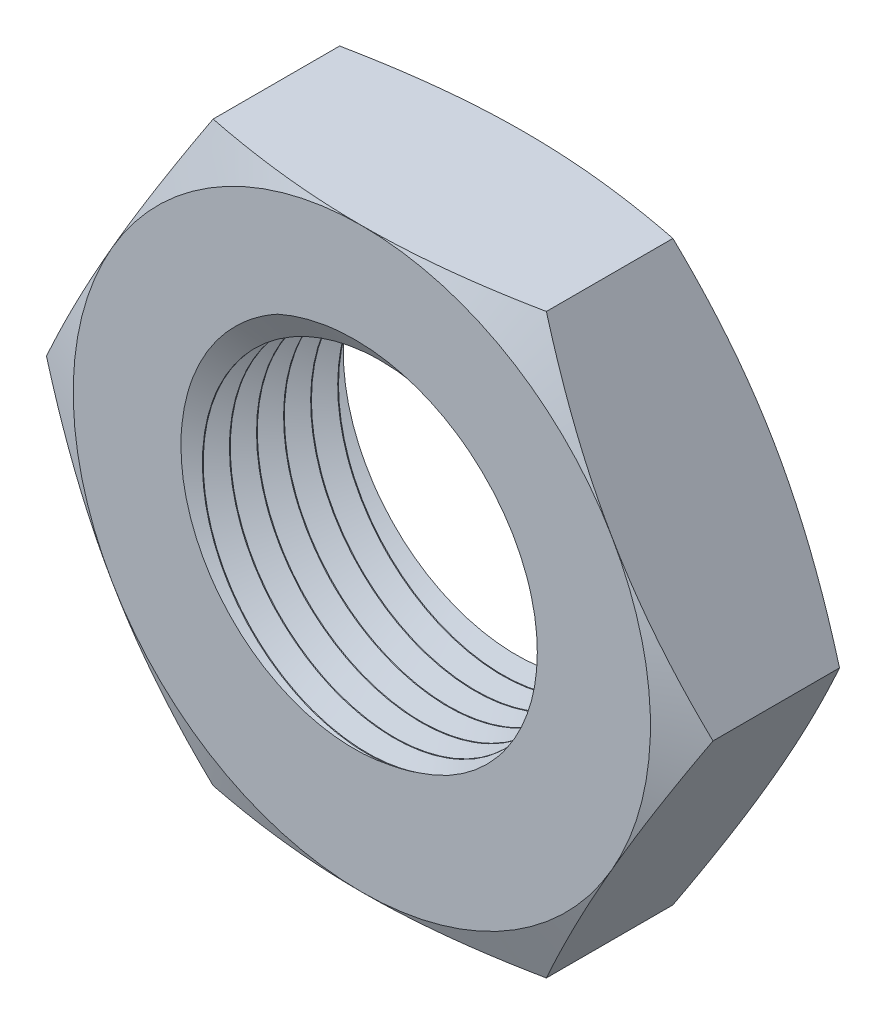
from build123d import *

# Parameters (mm, degrees)
CROQUIS1_R              = 9.25
SALIENTE_EXTRUIR1_DEPTH = 9
CORTAR_BARRER1_PITCH    = 1.5


with BuildPart() as part:
    # Croquis1 → Saliente-Extruir1 (new body)
    with BuildSketch(Plane.XY):
        Polygon((18.475208614, 0), (9.237604307, 16), (-9.237604307, 16), (-18.475208614, 0), (-9.237604307, -16), (9.237604307, -16), align=None)
        Circle(CROQUIS1_R, mode=Mode.SUBTRACT)
    extrude(amount=SALIENTE_EXTRUIR1_DEPTH)

    # Croquis2 → Cortar-Revolución2 (revolve, cut)
    with BuildSketch(Plane(origin=(0, 0, 0), x_dir=(0, 0, -1), z_dir=(1, 0, 0))):
        Polygon((-2, 20.988569027), (0, 20.988569027), (0, 16), align=None)
        Polygon((-9, 16), (-7, 20.988569027), (-9, 20.988569027), align=None)
    revolve(axis=Axis((0, 0, 0), (0, 0, 1)), mode=Mode.SUBTRACT)

    # Cortar-Barrer1: the profile of Croquis4 screwed along a right-hand helix of 20.5 turns, 8 arcs to a turn; built about Z, then put on its axis
    cortar_barrer1_z = Axis((0, 0, 0), (0, 0, 1))
    cortar_barrer1_corners = [(9.235628204, -0.000391228, 0.015158623), (9.23314353, -0.038396641, 1.48772813), (10.508602633, -0.018113402, 0.701827496)]
    with BuildLine(mode=Mode.PRIVATE) as cortar_barrer1_profile:
        Line(cortar_barrer1_corners[0], cortar_barrer1_corners[1])
        Line(cortar_barrer1_corners[1], cortar_barrer1_corners[2])
        Line(cortar_barrer1_corners[2], cortar_barrer1_corners[0])
    cortar_barrer1_cap = Face(cortar_barrer1_profile.wire())
    cortar_barrer1_turn_angles = [0, 22.5, 45, 67.5, 90, 112.5, 135, 157.5, 180, 202.5, 225, 247.5, 270, 292.5, 315, 337.5, 360]
    cortar_barrer1_turn_weights = [1, 0.9238795325112867, 1, 0.9238795325112867, 1, 0.9238795325112867, 1, 0.9238795325112867, 1, 0.9238795325112867, 1, 0.9238795325112867, 1, 0.9238795325112867, 1, 0.9238795325112867, 1]
    cortar_barrer1_turn_rails = [Edge.make_bspline([Vector(p[0], p[1], 0).rotate(cortar_barrer1_z, cortar_barrer1_turn_angles[k]) / cortar_barrer1_turn_weights[k] + Vector(0, 0, p[2] + CORTAR_BARRER1_PITCH * cortar_barrer1_turn_angles[k] / 360) for k in range(17)], [0, 0, 0, 1, 1, 2, 2, 3, 3, 4, 4, 5, 5, 6, 6, 7, 7, 8, 8, 8], 2, cortar_barrer1_turn_weights) for p in cortar_barrer1_corners]
    cortar_barrer1_turn_sides = [Face.make_surface_from_curves(cortar_barrer1_turn_rails[p[0]], cortar_barrer1_turn_rails[p[1]]) for p in [(0, 1), (1, 2), (2, 0)]]
    cortar_barrer1_last_angles = [7200, 7222.5, 7245, 7267.5, 7290, 7312.5, 7335, 7357.5, 7380]
    cortar_barrer1_last_weights = [1, 0.9238795325112867, 1, 0.9238795325112867, 1, 0.9238795325112867, 1, 0.9238795325112837, 1]
    cortar_barrer1_last_rails = [Edge.make_bspline([Vector(p[0], p[1], 0).rotate(cortar_barrer1_z, cortar_barrer1_last_angles[k]) / cortar_barrer1_last_weights[k] + Vector(0, 0, p[2] + CORTAR_BARRER1_PITCH * cortar_barrer1_last_angles[k] / 360) for k in range(9)], [0, 0, 0, 1, 1, 2, 2, 3, 3, 4, 4, 4], 2, cortar_barrer1_last_weights) for p in cortar_barrer1_corners]
    cortar_barrer1_last_sides = [Face.make_surface_from_curves(cortar_barrer1_last_rails[p[0]], cortar_barrer1_last_rails[p[1]]) for p in [(0, 1), (1, 2), (2, 0)]]
    cortar_barrer1 = Plane(origin=(0, 0, -10), x_dir=(0.7071067811865512, 0.7071067811865438, 0), z_dir=(0, 0, 1)) * Solid(Shell([*[p.moved(Location((0, 0, CORTAR_BARRER1_PITCH * i))) for i in range(20) for p in cortar_barrer1_turn_sides], *cortar_barrer1_last_sides, cortar_barrer1_cap, cortar_barrer1_cap.rotate(cortar_barrer1_z, 7380).moved(Location((0, 0, CORTAR_BARRER1_PITCH * 7380 / 360)))]))
    add(cortar_barrer1, mode=Mode.SUBTRACT)


solid = part.part
